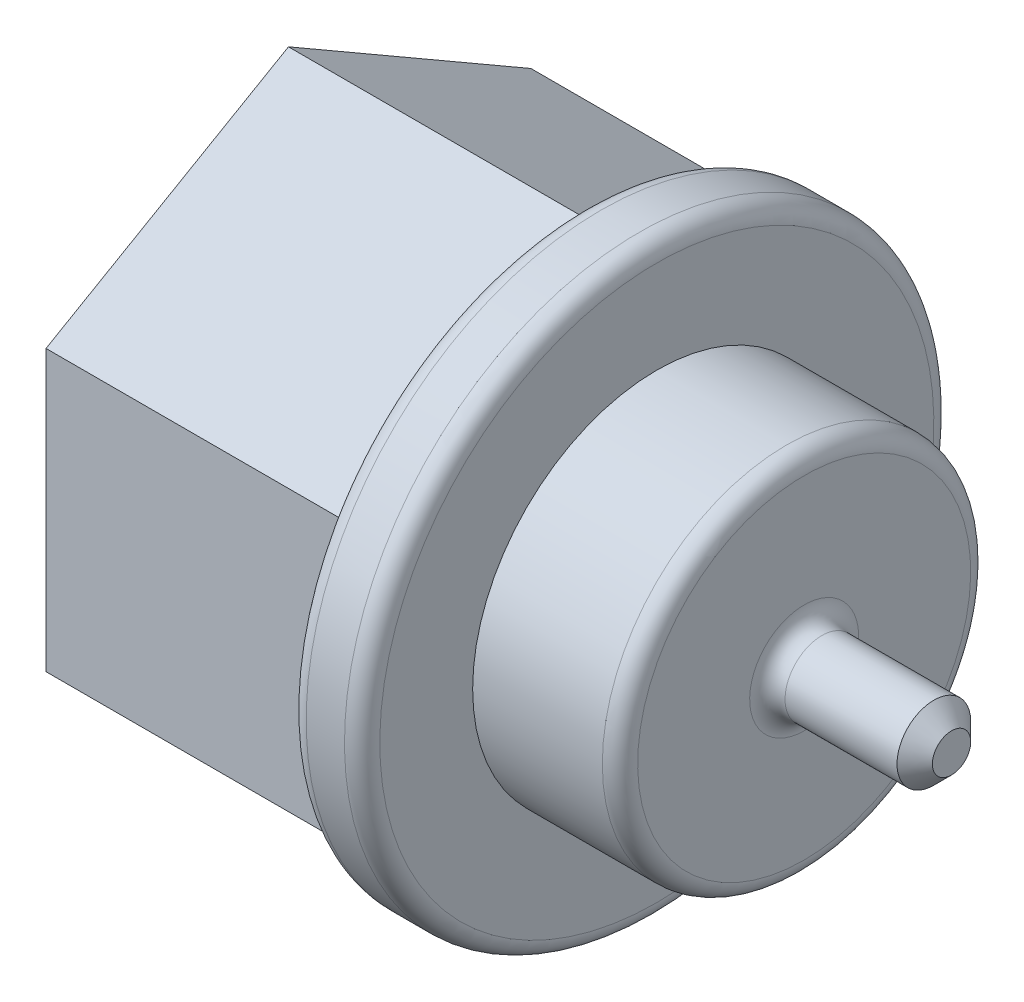
from build123d import *

# Parameters (mm, degrees)
SKETCH2_R           = 9.686596497
SKETCH2_R_2         = 4.7625
BOSS_EXTRUDE1_DEPTH = 12.7
CHAMFER1_SIZE       = 0.762
FILLET1_R           = 0.762
FILLET2_R           = 0.762


with BuildPart() as part:
    # Sketch1 → Revolve1 (revolve)
    with BuildSketch(Plane.XY, mode=Mode.PRIVATE) as revolve1_sk:
        Polygon((3.175, 7.9375), (9.525, 7.9375), (9.525, 1.5875), (15.875, 1.5875), (15.875, 0), (0, 0), (0, 12.7), (3.175, 12.7), align=None)
    revolve(revolve1_sk.sketch.rotate(Axis((0, 0, 0), (1, 0, 0)), 180), axis=Axis((0, 0, 0), (1, 0, 0)))

    # Sketch2 → Boss-Extrude1 (add)
    # profile 1 of 2: a face of its own
    with BuildSketch(Plane.ZY):
        Polygon((0, -12.065), (10.448596497, -6.0325), (10.448596497, 6.0325), (0, 12.065), (-10.448596497, 6.0325), (-10.448596497, -6.0325), align=None)
        with Locations(Location((0, 0, 0), (0, 0, 270))):
            Circle(SKETCH2_R, mode=Mode.SUBTRACT)
    # profile 2 of 2: a face of its own
    with BuildSketch(Plane.ZY):
        with Locations(Location((0, 0, 0), (0, 0, 270))):
            Circle(SKETCH2_R_2)
    extrude(amount=BOSS_EXTRUDE1_DEPTH)

    # Sketch5 → 5/16-18 Tapped Hole1 (revolve, cut)
    with BuildSketch(Plane(origin=(-12.7, 0, 0), x_dir=(0, 0, 1), z_dir=(0, 1, 0))):
        Polygon((0, 0), (0, 14.605), (3.2639, 12.643851026), (3.2639, 13.1953), (3.96875, 13.1953), (3.96875, 0), align=None)
    revolve(axis=Axis((-19.05, 0, 0), (1, 0, 0)), mode=Mode.SUBTRACT)

    # Chamfer1
    chamfer1_edges = [part.edges().sort_by_distance(p)[0] for p in [
        (15.875, 1.5875, 0),
    ]]
    chamfer(chamfer1_edges, length=CHAMFER1_SIZE)

    # Fillet1
    # the kernel refuses this fillet: 0.762 mm, written as the material it adds along each edge
    with BuildSketch(Plane(origin=(9.525, 0, 0), x_dir=(0, -1, 0), z_dir=(0, 0, 1))) as fillet1_piece_1:
        with BuildLine():
            CenterArc((1.5875 + FILLET1_R, FILLET1_R), FILLET1_R, 180, 90)
            Line((1.5875 + FILLET1_R, 0), (1.5875, 0))
            Line((1.5875, 0), (1.5875, FILLET1_R))
        make_face()
    revolve(axis=Axis((9.525, 0, 0), (1, 0, 0)))
    # the kernel refuses this fillet: 0.762 mm, written as the material it takes off along each edge
    with BuildSketch(Plane(origin=(3.175, 0, 0), x_dir=(0, -1, 0), z_dir=(0, 0, 1))) as fillet1_2_piece_1:
        with BuildLine():
            CenterArc((12.7 - FILLET1_R, -FILLET1_R), FILLET1_R, 0, 90)
            Line((12.7, -FILLET1_R), (12.7, 0))
            Line((12.7, 0), (12.7 - FILLET1_R, 0))
        make_face()
    revolve(axis=Axis((3.175, 0, 0), (1, 0, 0)), mode=Mode.SUBTRACT)
    with BuildSketch(Plane(origin=(9.525, 0, 0), x_dir=(0, -1, 0), z_dir=(0, 0, 1))) as fillet1_2_piece_2:
        with BuildLine():
            CenterArc((7.9375 - FILLET1_R, -FILLET1_R), FILLET1_R, 0, 90)
            Line((7.9375, -FILLET1_R), (7.9375, 0))
            Line((7.9375, 0), (7.9375 - FILLET1_R, 0))
        make_face()
    revolve(axis=Axis((9.525, 0, 0), (1, 0, 0)), mode=Mode.SUBTRACT)
    with BuildSketch(Plane(origin=(0, 0, 0), x_dir=(0, -1, 0), z_dir=(0, 0, 1))) as fillet1_2_piece_3_section:
        with BuildLine():
            CenterArc((12.7 - FILLET1_R, FILLET1_R), FILLET1_R, 270, 90)
            Line((12.7 - FILLET1_R, 0), (12.7, 0))
            Line((12.7, 0), (12.7, FILLET1_R))
        make_face()
    fillet1_2_piece_3 = revolve(axis=Axis((0, 0, 0), (1, 0, 0)), mode=Mode.PRIVATE)
    fillet1_2_piece_3 = split(fillet1_2_piece_3, bisect_by=Plane(origin=(0.195155167, -12.189466194, 0.215581772), z_dir=(0, -0.8660254037844387, -0.5000000000000003)), keep=Keep.TOP, mode=Mode.PRIVATE)
    add(fillet1_2_piece_3, mode=Mode.SUBTRACT)
    with BuildSketch(Plane(origin=(0, 0, 0), x_dir=(0, -1, 0), z_dir=(0, 0, 1))) as fillet1_2_piece_4_section:
        with BuildLine():
            CenterArc((12.7 - FILLET1_R, FILLET1_R), FILLET1_R, 270, 90)
            Line((12.7 - FILLET1_R, 0), (12.7, 0))
            Line((12.7, 0), (12.7, FILLET1_R))
        make_face()
    fillet1_2_piece_4 = revolve(axis=Axis((0, 0, 0), (1, 0, 0)), mode=Mode.PRIVATE)
    fillet1_2_piece_4 = split(fillet1_2_piece_4, bisect_by=Plane(origin=(0.215190513, -9.04875, 5.224298248), z_dir=(0, -0.8660254037844386, 0.5000000000000001)), keep=Keep.TOP, mode=Mode.PRIVATE)
    add(fillet1_2_piece_4, mode=Mode.SUBTRACT)
    with BuildSketch(Plane(origin=(0, 0, 0), x_dir=(0, -1, 0), z_dir=(0, 0, 1))) as fillet1_2_piece_5_section:
        with BuildLine():
            CenterArc((12.7 - FILLET1_R, FILLET1_R), FILLET1_R, 270, 90)
            Line((12.7 - FILLET1_R, 0), (12.7, 0))
            Line((12.7, 0), (12.7, FILLET1_R))
        make_face()
    fillet1_2_piece_5 = revolve(axis=Axis((0, 0, 0), (1, 0, 0)), mode=Mode.PRIVATE)
    fillet1_2_piece_5 = split(fillet1_2_piece_5, bisect_by=Plane(origin=(0.215190507, 0, -10.448596497), z_dir=(0, 0, -1)), keep=Keep.TOP, mode=Mode.PRIVATE)
    add(fillet1_2_piece_5, mode=Mode.SUBTRACT)
    with BuildSketch(Plane(origin=(0, 0, 0), x_dir=(0, -1, 0), z_dir=(0, 0, 1))) as fillet1_2_piece_6_section:
        with BuildLine():
            CenterArc((12.7 - FILLET1_R, FILLET1_R), FILLET1_R, 270, 90)
            Line((12.7 - FILLET1_R, 0), (12.7, 0))
            Line((12.7, 0), (12.7, FILLET1_R))
        make_face()
    fillet1_2_piece_6 = revolve(axis=Axis((0, 0, 0), (1, 0, 0)), mode=Mode.PRIVATE)
    fillet1_2_piece_6 = split(fillet1_2_piece_6, bisect_by=Plane(origin=(0.215190507, 0, 10.448596497), z_dir=(0, 0, 1)), keep=Keep.TOP, mode=Mode.PRIVATE)
    add(fillet1_2_piece_6, mode=Mode.SUBTRACT)
    with BuildSketch(Plane(origin=(0, 0, 0), x_dir=(0, -1, 0), z_dir=(0, 0, 1))) as fillet1_2_piece_7_section:
        with BuildLine():
            CenterArc((12.7 - FILLET1_R, FILLET1_R), FILLET1_R, 270, 90)
            Line((12.7 - FILLET1_R, 0), (12.7, 0))
            Line((12.7, 0), (12.7, FILLET1_R))
        make_face()
    fillet1_2_piece_7 = revolve(axis=Axis((0, 0, 0), (1, 0, 0)), mode=Mode.PRIVATE)
    fillet1_2_piece_7 = split(fillet1_2_piece_7, bisect_by=Plane(origin=(0.215190506, 9.048749998, -5.224298251), z_dir=(0, 0.8660254037844386, -0.5000000000000002)), keep=Keep.TOP, mode=Mode.PRIVATE)
    add(fillet1_2_piece_7, mode=Mode.SUBTRACT)
    with BuildSketch(Plane(origin=(0, 0, 0), x_dir=(0, -1, 0), z_dir=(0, 0, 1))) as fillet1_2_piece_8_section:
        with BuildLine():
            CenterArc((12.7 - FILLET1_R, FILLET1_R), FILLET1_R, 270, 90)
            Line((12.7 - FILLET1_R, 0), (12.7, 0))
            Line((12.7, 0), (12.7, FILLET1_R))
        make_face()
    fillet1_2_piece_8 = revolve(axis=Axis((0, 0, 0), (1, 0, 0)), mode=Mode.PRIVATE)
    fillet1_2_piece_8 = split(fillet1_2_piece_8, bisect_by=Plane(origin=(0.215190507, 9.048750002, 5.224298244), z_dir=(0, 0.8660254037844387, 0.5000000000000001)), keep=Keep.TOP, mode=Mode.PRIVATE)
    add(fillet1_2_piece_8, mode=Mode.SUBTRACT)

    # Fillet2
    fillet2_edges = [part.edges().sort_by_distance(p)[0] for p in [
        (0, 4.7625, 0),
        (0, 9.686596497, 0),
    ]]
    fillet(fillet2_edges, radius=FILLET2_R)


solid = part.part
